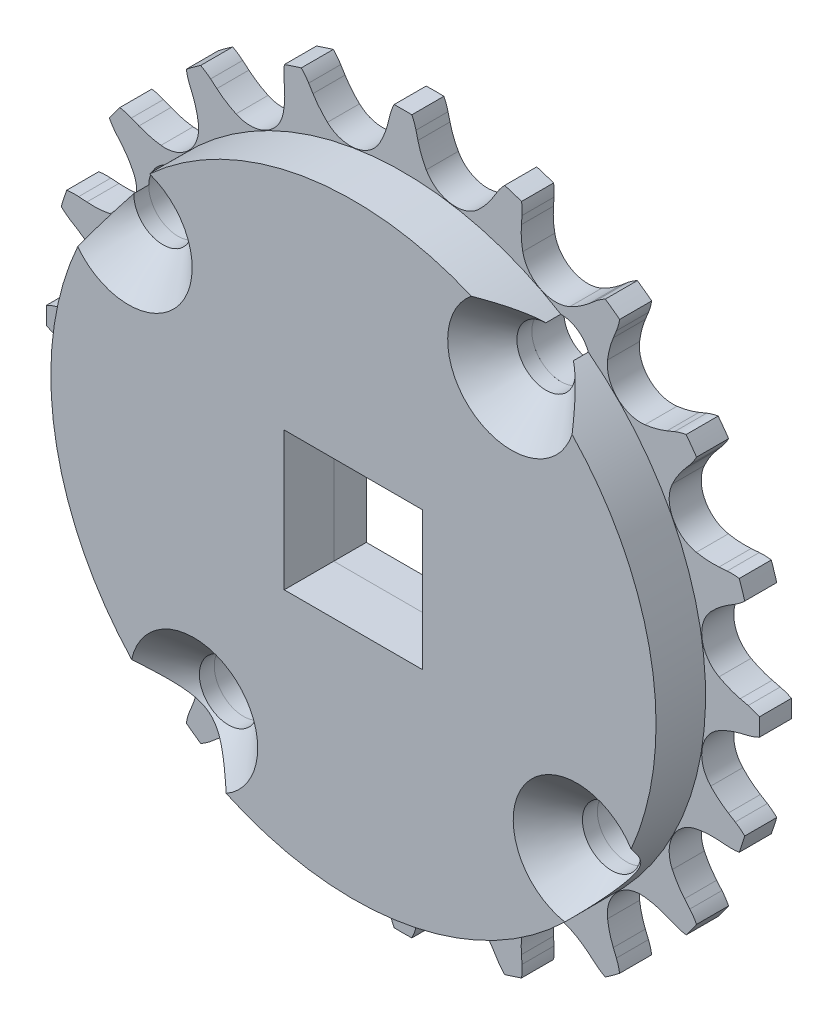
from build123d import *

# Parameters (mm, degrees)
SKETCH1_R                                    = 6.787119857
BOSS_EXTRUDE1_DEPTH                          = 2.3622
SKETCH2_R                                    = 18
BOSS_EXTRUDE2_DEPTH                          = 2.4
CUT_EXTRUDE1_START                           = -2.4
CUT_EXTRUDE1_OUTLINE_W                       = 10.2
CUT_EXTRUDE1_OUTLINE_H                       = 10.2
CUT_EXTRUDE1_DEPTH                           = 2.4
BOSS_EXTRUDE3_OUTLINE_R                      = 22.300536673
BOSS_EXTRUDE3_OUTLINE_W                      = 10.2
BOSS_EXTRUDE3_OUTLINE_H                      = 10.2
BOSS_EXTRUDE3_DEPTH                          = 3.65
SKETCH5_R                                    = 2
CUT_EXTRUDE3_DEPTH                           = 38.642889197
CSK_FOR_M4_COUNTERSUNK_FLAT_HEAD_SCR_2_COUNT = 2
CSK_FOR_M4_COUNTERSUNK_FLAT_HEAD_SCR_2_PITCH = 28.640006983
CSK_FOR_M4_COUNTERSUNK_FLAT_HEAD_SCR_3_COUNT = 2
CSK_FOR_M4_COUNTERSUNK_FLAT_HEAD_SCR_3_PITCH = 40.503086302
CSK_FOR_M4_COUNTERSUNK_FLAT_HEAD_SCR_4_COUNT = 2
CSK_FOR_M4_COUNTERSUNK_FLAT_HEAD_SCR_4_PITCH = 28.640006983


# Read off the part's stored shape, not the designer's step: Cut-Extrude1, Boss-Extrude3
with BuildPart() as part:
    # Sketch1 → Boss-Extrude1 (new body)
    with BuildSketch(Plane.XY.offset(0.25)):
        with BuildLine():
            Line((-24.488227524, 6.948596415), (-23.976513369, 6.631320197))
            ThreePointArc((-23.976513369, 6.631320197), (-23.291994454, 6.141252786), (-22.678303214, 5.564958353))
            ThreePointArc((-22.678303214, 5.564958353), (-22.044379306, 3.491486679), (-23.288014754, 1.715391192))
            ThreePointArc((-23.288014754, 1.715391192), (-24.04975458, 1.356943638), (-24.852209913, 1.102389812))
            Line((-24.852209913, 1.102389812), (-25.436922738, 0.958770568))
            ThreePointArc((-25.436922738, 0.958770568), (-25.860833079, 0.829247508), (-26.267723996, 0.653418098))
            ThreePointArc((-26.267723996, 0.653418098), (-26.275849732, 0), (-26.267723996, -0.653418098))
            ThreePointArc((-26.267723996, -0.653418098), (-25.860833079, -0.829247508), (-25.436922738, -0.958770568))
            Line((-25.436922738, -0.958770568), (-24.852209913, -1.102389812))
            ThreePointArc((-24.852209913, -1.102389812), (-24.04975458, -1.356943638), (-23.288014754, -1.715391192))
            ThreePointArc((-23.288014754, -1.715391192), (-22.044379306, -3.491486679), (-22.678303214, -5.564958353))
            ThreePointArc((-22.678303214, -5.564958353), (-23.291994454, -6.141252786), (-23.976513369, -6.631320197))
            Line((-23.976513369, -6.631320197), (-24.488227524, -6.948596415))
            ThreePointArc((-24.488227524, -6.948596415), (-24.851365389, -7.202775664), (-25.184007371, -7.495735579))
            ThreePointArc((-25.184007371, -7.495735579), (-24.989818108, -8.119684109), (-24.780172778, -8.738610658))
            ThreePointArc((-24.780172778, -8.738610658), (-24.338862244, -8.780098157), (-23.895674726, -8.772286407))
            Line((-23.895674726, -8.772286407), (-23.295198996, -8.728190226))
            ThreePointArc((-23.295198996, -8.728190226), (-22.453357164, -8.722312965), (-21.618133153, -8.827826296))
            ThreePointArc((-21.618133153, -8.827826296), (-19.886521867, -10.132688993), (-19.848681346, -12.300571001))
            ThreePointArc((-19.848681346, -12.300571001), (-20.254251625, -13.0383006), (-20.753828642, -13.715910381))
            Line((-20.753828642, -13.715910381), (-21.14245398, -14.175786366))
            ThreePointArc((-21.14245398, -14.175786366), (-21.409272906, -14.529740969), (-21.635104637, -14.911154431))
            ThreePointArc((-21.635104637, -14.911154431), (-21.257608974, -15.444556964), (-20.866965595, -15.968407121))
            ThreePointArc((-20.866965595, -15.968407121), (-20.434433994, -15.871491623), (-20.01535158, -15.727109732))
            Line((-20.01535158, -15.727109732), (-19.457891694, -15.499614567))
            ThreePointArc((-19.457891694, -15.499614567), (-18.659068707, -15.233881527), (-17.832118057, -15.076132254))
            ThreePointArc((-17.832118057, -15.076132254), (-15.782033111, -15.782033111), (-15.076132254, -17.832118057))
            ThreePointArc((-15.076132254, -17.832118057), (-15.233881527, -18.659068707), (-15.499614567, -19.457891694))
            Line((-15.499614567, -19.457891694), (-15.727109732, -20.01535158))
            ThreePointArc((-15.727109732, -20.01535158), (-15.871491623, -20.434433994), (-15.968407121, -20.866965595))
            ThreePointArc((-15.968407121, -20.866965595), (-15.444556964, -21.257608974), (-14.911154431, -21.635104637))
            ThreePointArc((-14.911154431, -21.635104637), (-14.529740969, -21.409272906), (-14.175786366, -21.14245398))
            Line((-14.175786366, -21.14245398), (-13.715910381, -20.753828642))
            ThreePointArc((-13.715910381, -20.753828642), (-13.0383006, -20.254251625), (-12.300571001, -19.848681346))
            ThreePointArc((-12.300571001, -19.848681346), (-10.132688993, -19.886521867), (-8.827826296, -21.618133153))
            ThreePointArc((-8.827826296, -21.618133153), (-8.722312965, -22.453357164), (-8.728190226, -23.295198996))
            Line((-8.728190226, -23.295198996), (-8.772286407, -23.895674726))
            ThreePointArc((-8.772286407, -23.895674726), (-8.780098157, -24.338862244), (-8.738610658, -24.780172778))
            ThreePointArc((-8.738610658, -24.780172778), (-8.119684109, -24.989818108), (-7.495735579, -25.184007371))
            ThreePointArc((-7.495735579, -25.184007371), (-7.202775664, -24.851365389), (-6.948596415, -24.488227524))
            Line((-6.948596415, -24.488227524), (-6.631320197, -23.976513369))
            ThreePointArc((-6.631320197, -23.976513369), (-6.141252786, -23.291994454), (-5.564958353, -22.678303214))
            ThreePointArc((-5.564958353, -22.678303214), (-3.491486679, -22.044379306), (-1.715391192, -23.288014754))
            ThreePointArc((-1.715391192, -23.288014754), (-1.356943638, -24.04975458), (-1.102389812, -24.852209913))
            Line((-1.102389812, -24.852209913), (-0.958770568, -25.436922738))
            ThreePointArc((-0.958770568, -25.436922738), (-0.829247508, -25.860833079), (-0.653418098, -26.267723996))
            ThreePointArc((-0.653418098, -26.267723996), (0, -26.275849732), (0.653418098, -26.267723996))
            ThreePointArc((0.653418098, -26.267723996), (0.829247508, -25.860833079), (0.958770568, -25.436922738))
            Line((0.958770568, -25.436922738), (1.102389812, -24.852209913))
            ThreePointArc((1.102389812, -24.852209913), (1.356943638, -24.04975458), (1.715391192, -23.288014754))
            ThreePointArc((1.715391192, -23.288014754), (3.491486679, -22.044379306), (5.564958353, -22.678303214))
            ThreePointArc((5.564958353, -22.678303214), (6.141252786, -23.291994454), (6.631320197, -23.976513369))
            Line((6.631320197, -23.976513369), (6.948596415, -24.488227524))
            ThreePointArc((6.948596415, -24.488227524), (7.202775664, -24.851365389), (7.495735579, -25.184007371))
            ThreePointArc((7.495735579, -25.184007371), (8.119684109, -24.989818108), (8.738610658, -24.780172778))
            ThreePointArc((8.738610658, -24.780172778), (8.780098157, -24.338862244), (8.772286407, -23.895674726))
            Line((8.772286407, -23.895674726), (8.728190226, -23.295198996))
            ThreePointArc((8.728190226, -23.295198996), (8.722312965, -22.453357164), (8.827826296, -21.618133153))
            ThreePointArc((8.827826296, -21.618133153), (10.132688993, -19.886521867), (12.300571001, -19.848681346))
            ThreePointArc((12.300571001, -19.848681346), (13.0383006, -20.254251625), (13.715910381, -20.753828642))
            Line((13.715910381, -20.753828642), (14.175786366, -21.14245398))
            ThreePointArc((14.175786366, -21.14245398), (14.529740969, -21.409272906), (14.911154431, -21.635104637))
            ThreePointArc((14.911154431, -21.635104637), (15.444556964, -21.257608974), (15.968407121, -20.866965595))
            ThreePointArc((15.968407121, -20.866965595), (15.871491623, -20.434433994), (15.727109732, -20.01535158))
            Line((15.727109732, -20.01535158), (15.499614567, -19.457891694))
            ThreePointArc((15.499614567, -19.457891694), (15.233881527, -18.659068707), (15.076132254, -17.832118057))
            ThreePointArc((15.076132254, -17.832118057), (15.782033111, -15.782033111), (17.832118057, -15.076132254))
            ThreePointArc((17.832118057, -15.076132254), (18.659068707, -15.233881527), (19.457891694, -15.499614567))
            Line((19.457891694, -15.499614567), (20.01535158, -15.727109732))
            ThreePointArc((20.01535158, -15.727109732), (20.434433994, -15.871491623), (20.866965595, -15.968407121))
            ThreePointArc((20.866965595, -15.968407121), (21.257608974, -15.444556964), (21.635104637, -14.911154431))
            ThreePointArc((21.635104637, -14.911154431), (21.409272906, -14.529740969), (21.14245398, -14.175786366))
            Line((21.14245398, -14.175786366), (20.753828642, -13.715910381))
            ThreePointArc((20.753828642, -13.715910381), (20.254251625, -13.0383006), (19.848681346, -12.300571001))
            ThreePointArc((19.848681346, -12.300571001), (19.886521867, -10.132688993), (21.618133153, -8.827826296))
            ThreePointArc((21.618133153, -8.827826296), (22.453357164, -8.722312965), (23.295198996, -8.728190226))
            Line((23.295198996, -8.728190226), (23.895674726, -8.772286407))
            ThreePointArc((23.895674726, -8.772286407), (24.338862244, -8.780098157), (24.780172778, -8.738610658))
            ThreePointArc((24.780172778, -8.738610658), (24.989818108, -8.119684109), (25.184007371, -7.495735579))
            ThreePointArc((25.184007371, -7.495735579), (24.851365389, -7.202775664), (24.488227524, -6.948596415))
            Line((24.488227524, -6.948596415), (23.976513369, -6.631320197))
            ThreePointArc((23.976513369, -6.631320197), (23.291994454, -6.141252786), (22.678303214, -5.564958353))
            ThreePointArc((22.678303214, -5.564958353), (22.044379306, -3.491486679), (23.288014754, -1.715391192))
            ThreePointArc((23.288014754, -1.715391192), (24.04975458, -1.356943638), (24.852209913, -1.102389812))
            Line((24.852209913, -1.102389812), (25.436922738, -0.958770568))
            ThreePointArc((25.436922738, -0.958770568), (25.860833079, -0.829247508), (26.267723996, -0.653418098))
            ThreePointArc((26.267723996, -0.653418098), (26.275849732, 0), (26.267723996, 0.653418098))
            ThreePointArc((26.267723996, 0.653418098), (25.860833079, 0.829247508), (25.436922738, 0.958770568))
            Line((25.436922738, 0.958770568), (24.852209913, 1.102389812))
            ThreePointArc((24.852209913, 1.102389812), (24.04975458, 1.356943638), (23.288014754, 1.715391192))
            ThreePointArc((23.288014754, 1.715391192), (22.044379306, 3.491486679), (22.678303214, 5.564958353))
            ThreePointArc((22.678303214, 5.564958353), (23.291994454, 6.141252786), (23.976513369, 6.631320197))
            Line((23.976513369, 6.631320197), (24.488227524, 6.948596415))
            ThreePointArc((24.488227524, 6.948596415), (24.851365389, 7.202775664), (25.184007371, 7.495735579))
            ThreePointArc((25.184007371, 7.495735579), (24.989818108, 8.119684109), (24.780172778, 8.738610658))
            ThreePointArc((24.780172778, 8.738610658), (24.338862244, 8.780098157), (23.895674726, 8.772286407))
            Line((23.895674726, 8.772286407), (23.295198996, 8.728190226))
            ThreePointArc((23.295198996, 8.728190226), (22.453357164, 8.722312965), (21.618133153, 8.827826296))
            ThreePointArc((21.618133153, 8.827826296), (19.886521867, 10.132688993), (19.848681346, 12.300571001))
            ThreePointArc((19.848681346, 12.300571001), (20.254251625, 13.0383006), (20.753828642, 13.715910381))
            Line((20.753828642, 13.715910381), (21.14245398, 14.175786366))
            ThreePointArc((21.14245398, 14.175786366), (21.409272906, 14.529740969), (21.635104637, 14.911154431))
            ThreePointArc((21.635104637, 14.911154431), (21.257608974, 15.444556964), (20.866965595, 15.968407121))
            ThreePointArc((20.866965595, 15.968407121), (20.434433994, 15.871491623), (20.01535158, 15.727109732))
            Line((20.01535158, 15.727109732), (19.457891694, 15.499614567))
            ThreePointArc((19.457891694, 15.499614567), (18.659068707, 15.233881527), (17.832118057, 15.076132254))
            ThreePointArc((17.832118057, 15.076132254), (15.782033111, 15.782033111), (15.076132254, 17.832118057))
            ThreePointArc((15.076132254, 17.832118057), (15.233881527, 18.659068707), (15.499614567, 19.457891694))
            Line((15.499614567, 19.457891694), (15.727109732, 20.01535158))
            ThreePointArc((15.727109732, 20.01535158), (15.871491623, 20.434433994), (15.968407121, 20.866965595))
            ThreePointArc((15.968407121, 20.866965595), (15.444556964, 21.257608974), (14.911154431, 21.635104637))
            ThreePointArc((14.911154431, 21.635104637), (14.529740969, 21.409272906), (14.175786366, 21.14245398))
            Line((14.175786366, 21.14245398), (13.715910381, 20.753828642))
            ThreePointArc((13.715910381, 20.753828642), (13.0383006, 20.254251625), (12.300571001, 19.848681346))
            ThreePointArc((12.300571001, 19.848681346), (10.132688993, 19.886521867), (8.827826296, 21.618133153))
            ThreePointArc((8.827826296, 21.618133153), (8.722312965, 22.453357164), (8.728190226, 23.295198996))
            Line((8.728190226, 23.295198996), (8.772286407, 23.895674726))
            ThreePointArc((8.772286407, 23.895674726), (8.780098157, 24.338862244), (8.738610658, 24.780172778))
            ThreePointArc((8.738610658, 24.780172778), (8.119684109, 24.989818108), (7.495735579, 25.184007371))
            ThreePointArc((7.495735579, 25.184007371), (7.202775664, 24.851365389), (6.948596415, 24.488227524))
            Line((6.948596415, 24.488227524), (6.631320197, 23.976513369))
            ThreePointArc((6.631320197, 23.976513369), (6.141252786, 23.291994454), (5.564958353, 22.678303214))
            ThreePointArc((5.564958353, 22.678303214), (3.491486679, 22.044379306), (1.715391192, 23.288014754))
            ThreePointArc((1.715391192, 23.288014754), (1.356943638, 24.04975458), (1.102389812, 24.852209913))
            Line((1.102389812, 24.852209913), (0.958770568, 25.436922738))
            ThreePointArc((0.958770568, 25.436922738), (0.829247508, 25.860833079), (0.653418098, 26.267723996))
            ThreePointArc((0.653418098, 26.267723996), (0, 26.275849732), (-0.653418098, 26.267723996))
            ThreePointArc((-0.653418098, 26.267723996), (-0.829247508, 25.860833079), (-0.958770568, 25.436922738))
            Line((-0.958770568, 25.436922738), (-1.102389812, 24.852209913))
            ThreePointArc((-1.102389812, 24.852209913), (-1.356943638, 24.04975458), (-1.715391192, 23.288014754))
            ThreePointArc((-1.715391192, 23.288014754), (-3.491486679, 22.044379306), (-5.564958353, 22.678303214))
            ThreePointArc((-5.564958353, 22.678303214), (-6.141252786, 23.291994454), (-6.631320197, 23.976513369))
            Line((-6.631320197, 23.976513369), (-6.948596415, 24.488227524))
            ThreePointArc((-6.948596415, 24.488227524), (-7.202775664, 24.851365389), (-7.495735579, 25.184007371))
            ThreePointArc((-7.495735579, 25.184007371), (-8.119684109, 24.989818108), (-8.738610658, 24.780172778))
            ThreePointArc((-8.738610658, 24.780172778), (-8.780098157, 24.338862244), (-8.772286407, 23.895674726))
            Line((-8.772286407, 23.895674726), (-8.728190226, 23.295198996))
            ThreePointArc((-8.728190226, 23.295198996), (-8.722312965, 22.453357164), (-8.827826296, 21.618133153))
            ThreePointArc((-8.827826296, 21.618133153), (-10.132688993, 19.886521867), (-12.300571001, 19.848681346))
            ThreePointArc((-12.300571001, 19.848681346), (-13.0383006, 20.254251625), (-13.715910381, 20.753828642))
            Line((-13.715910381, 20.753828642), (-14.175786366, 21.14245398))
            ThreePointArc((-14.175786366, 21.14245398), (-14.529740969, 21.409272906), (-14.911154431, 21.635104637))
            ThreePointArc((-14.911154431, 21.635104637), (-15.444556964, 21.257608974), (-15.968407121, 20.866965595))
            ThreePointArc((-15.968407121, 20.866965595), (-15.871491623, 20.434433994), (-15.727109732, 20.01535158))
            Line((-15.727109732, 20.01535158), (-15.499614567, 19.457891694))
            ThreePointArc((-15.499614567, 19.457891694), (-15.233881527, 18.659068707), (-15.076132254, 17.832118057))
            ThreePointArc((-15.076132254, 17.832118057), (-15.782033111, 15.782033111), (-17.832118057, 15.076132254))
            ThreePointArc((-17.832118057, 15.076132254), (-18.659068707, 15.233881527), (-19.457891694, 15.499614567))
            Line((-19.457891694, 15.499614567), (-20.01535158, 15.727109732))
            ThreePointArc((-20.01535158, 15.727109732), (-20.434433994, 15.871491623), (-20.866965595, 15.968407121))
            ThreePointArc((-20.866965595, 15.968407121), (-21.257608974, 15.444556964), (-21.635104637, 14.911154431))
            ThreePointArc((-21.635104637, 14.911154431), (-21.409272906, 14.529740969), (-21.14245398, 14.175786366))
            Line((-21.14245398, 14.175786366), (-20.753828642, 13.715910381))
            ThreePointArc((-20.753828642, 13.715910381), (-20.254251625, 13.0383006), (-19.848681346, 12.300571001))
            ThreePointArc((-19.848681346, 12.300571001), (-19.886521867, 10.132688993), (-21.618133153, 8.827826296))
            ThreePointArc((-21.618133153, 8.827826296), (-22.453357164, 8.722312965), (-23.295198996, 8.728190226))
            Line((-23.295198996, 8.728190226), (-23.895674726, 8.772286407))
            ThreePointArc((-23.895674726, 8.772286407), (-24.338862244, 8.780098157), (-24.780172778, 8.738610658))
            ThreePointArc((-24.780172778, 8.738610658), (-24.989818108, 8.119684109), (-25.184007371, 7.495735579))
            ThreePointArc((-25.184007371, 7.495735579), (-24.851365389, 7.202775664), (-24.488227524, 6.948596415))
        make_face()
        with Locations(Location((0, 0, 0), (0, 0, 180))):
            Circle(SKETCH1_R, mode=Mode.SUBTRACT)
        with BuildLine():
            Line((6.385503129, 9.127913687), (6.856026394, 9.598436951))
            ThreePointArc((6.856026394, 9.598436951), (9.598436951, 9.598436951), (9.598436951, 6.856026394))
            Line((9.598436951, 6.856026394), (9.127913687, 6.385503129))
            ThreePointArc((9.127913687, 6.385503129), (6.385503129, 6.385503129), (6.385503129, 9.127913687))
        make_face(mode=Mode.SUBTRACT)
        with BuildLine():
            Line((9.127913687, -6.385503129), (9.598436951, -6.856026394))
            ThreePointArc((9.598436951, -6.856026394), (9.598436951, -9.598436951), (6.856026394, -9.598436951))
            Line((6.856026394, -9.598436951), (6.385503129, -9.127913687))
            ThreePointArc((6.385503129, -9.127913687), (6.385503129, -6.385503129), (9.127913687, -6.385503129))
        make_face(mode=Mode.SUBTRACT)
        with BuildLine():
            Line((-6.385503129, -9.127913687), (-6.856026394, -9.598436951))
            ThreePointArc((-6.856026394, -9.598436951), (-9.598436951, -9.598436951), (-9.598436951, -6.856026394))
            Line((-9.598436951, -6.856026394), (-9.127913687, -6.385503129))
            ThreePointArc((-9.127913687, -6.385503129), (-6.385503129, -6.385503129), (-6.385503129, -9.127913687))
        make_face(mode=Mode.SUBTRACT)
        with BuildLine():
            Line((1.939177102, 15.513416816), (1.939177102, 10.96964223))
            ThreePointArc((1.939177102, 10.96964223), (0, 9.030465128), (-1.939177102, 10.96964223))
            Line((-1.939177102, 10.96964223), (-1.939177102, 15.513416816))
            ThreePointArc((-1.939177102, 15.513416816), (0, 17.452593918), (1.939177102, 15.513416816))
        make_face(mode=Mode.SUBTRACT)
        with BuildLine():
            Line((-1.939177102, -15.513416816), (-1.939177102, -10.96964223))
            ThreePointArc((-1.939177102, -10.96964223), (0, -9.030465128), (1.939177102, -10.96964223))
            Line((1.939177102, -10.96964223), (1.939177102, -15.513416816))
            ThreePointArc((1.939177102, -15.513416816), (0, -17.452593918), (-1.939177102, -15.513416816))
        make_face(mode=Mode.SUBTRACT)
        with BuildLine():
            Line((15.513416816, -1.939177102), (10.96964223, -1.939177102))
            ThreePointArc((10.96964223, -1.939177102), (9.030465128, 0), (10.96964223, 1.939177102))
            Line((10.96964223, 1.939177102), (15.513416816, 1.939177102))
            ThreePointArc((15.513416816, 1.939177102), (17.452593918, 0), (15.513416816, -1.939177102))
        make_face(mode=Mode.SUBTRACT)
        with BuildLine():
            Line((-15.513416816, 1.939177102), (-10.96964223, 1.939177102))
            ThreePointArc((-10.96964223, 1.939177102), (-9.030465128, 0), (-10.96964223, -1.939177102))
            Line((-10.96964223, -1.939177102), (-15.513416816, -1.939177102))
            ThreePointArc((-15.513416816, -1.939177102), (-17.452593918, 0), (-15.513416816, 1.939177102))
        make_face(mode=Mode.SUBTRACT)
        with BuildLine():
            Line((-6.856026394, 9.598436951), (-6.385503129, 9.127913687))
            ThreePointArc((-6.385503129, 9.127913687), (-6.385503129, 6.385503129), (-9.127913687, 6.385503129))
            Line((-9.127913687, 6.385503129), (-9.598436951, 6.856026394))
            ThreePointArc((-9.598436951, 6.856026394), (-9.598436951, 9.598436951), (-6.856026394, 9.598436951))
        make_face(mode=Mode.SUBTRACT)
    extrude(amount=-BOSS_EXTRUDE1_DEPTH)


with BuildPart() as body_2:
    # Sketch2 → Boss-Extrude2 (new body)
    with BuildSketch(Plane.XY.offset(0.25)):
        Circle(SKETCH2_R)
    extrude(amount=-BOSS_EXTRUDE2_DEPTH)


with BuildPart() as cut_extrude1_tool:
    # Cut-Extrude1 outline → Cut-Extrude1 (new body)
    with BuildSketch(Plane.XY.offset(0.25).offset(CUT_EXTRUDE1_START)):
        Rectangle(CUT_EXTRUDE1_OUTLINE_W, CUT_EXTRUDE1_OUTLINE_H)
    extrude(amount=CUT_EXTRUDE1_DEPTH)


with BuildPart() as part_1:
    add(part.part)

    # Cut-Extrude1: cut by cut_extrude1_tool
    add(cut_extrude1_tool.part, mode=Mode.SUBTRACT)


with BuildPart() as body_2_1:
    add(body_2.part)

    # Cut-Extrude1: cut by cut_extrude1_tool
    add(cut_extrude1_tool.part, mode=Mode.SUBTRACT)


with BuildPart() as body_3:
    # Boss-Extrude3 outline → Boss-Extrude3 (new body)
    with BuildSketch(Plane.XY.offset(0.25)):
        Circle(BOSS_EXTRUDE3_OUTLINE_R)
        Rectangle(BOSS_EXTRUDE3_OUTLINE_W, BOSS_EXTRUDE3_OUTLINE_H, mode=Mode.SUBTRACT)
    extrude(amount=BOSS_EXTRUDE3_DEPTH)


with BuildPart() as cut_extrude3_tool:
    # Sketch5 → Cut-Extrude3 (new, through all)
    with BuildSketch(Plane(origin=(0, 0, -2.1122), x_dir=(-1, 0, 0), z_dir=(0, 0, -1))):
        with BuildLine():
            ThreePointArc((18.584848385, 12.049597672), (18.486961417, 12.667631661), (18.202882373, 13.225168177))
            Line((18.202882373, 13.225168177), (14.966814396, 10.874027167))
            ThreePointArc((14.966814396, 10.874027167), (17.202882373, 10.147484639), (18.584848385, 12.049597672))
        make_face()
        with BuildLine():
            Line((14.966814396, 10.874027167), (18.202882373, 13.225168177))
            ThreePointArc((18.202882373, 13.225168177), (15.40927788, 13.667631661), (14.966814396, 10.874027167))
        make_face()
        with Locations((11.755705046, -16.180339887)):
            Circle(SKETCH5_R)
        with Locations((-16.474232514, -11.351196549)):
            Circle(SKETCH5_R)
        with Locations((-11.645089175, 16.878741011)):
            Circle(SKETCH5_R)
    extrude(amount=-CUT_EXTRUDE3_DEPTH)


with BuildPart() as part_2:
    add(part_1.part)

    # Cut-Extrude3: cut by cut_extrude3_tool
    add(cut_extrude3_tool.part, mode=Mode.SUBTRACT)


with BuildPart() as body_3_1:
    add(body_3.part)

    # Cut-Extrude3: cut by cut_extrude3_tool
    add(cut_extrude3_tool.part, mode=Mode.SUBTRACT)


with BuildPart() as csk_for_m4_countersunk_flat_head_screw1_tool:
    # Sketch8 → CSK for M4 Countersunk Flat Head Screw1 (revolve)
    with BuildSketch(Plane(origin=(-16.584848385, 12.049597672, 3.9), x_dir=(0, -1, 0), z_dir=(1, 0, 0))):
        Polygon((0, 0), (0, 6.0122), (2.15, 6.0122), (2.15, 2.55), (4.7, 0), align=None)
    csk_for_m4_countersunk_flat_head_screw1 = revolve(axis=Axis((-16.584848385, 12.049597672, 10.25), (0, 0, -1)))


with BuildPart() as part_3:
    add(part_2.part)

    # CSK for M4 Countersunk Flat Head Screw1: cut by csk_for_m4_countersunk_flat_head_screw1_tool
    add(csk_for_m4_countersunk_flat_head_screw1_tool.part, mode=Mode.SUBTRACT)


with BuildPart() as body_3_2:
    add(body_3_1.part)

    # CSK for M4 Countersunk Flat Head Screw1: cut by csk_for_m4_countersunk_flat_head_screw1_tool
    add(csk_for_m4_countersunk_flat_head_screw1_tool.part, mode=Mode.SUBTRACT)


with BuildPart() as csk_for_m4_countersunk_flat_head_scr_2_tool:
    # CSK for M4 Countersunk Flat Head Scr 2: CSK for M4 Countersunk Flat Head Screw1 ×2
    with Locations(*[Vector(0.16861529892999055, -0.9856819370196199, 0) * (i * CSK_FOR_M4_COUNTERSUNK_FLAT_HEAD_SCR_2_PITCH) for i in range(1, CSK_FOR_M4_COUNTERSUNK_FLAT_HEAD_SCR_2_COUNT)]):
        add(csk_for_m4_countersunk_flat_head_screw1)


with BuildPart() as part_4:
    add(part_3.part)

    # CSK for M4 Countersunk Flat Head Scr 2: cut by csk_for_m4_countersunk_flat_head_scr_2_tool
    add(csk_for_m4_countersunk_flat_head_scr_2_tool.part, mode=Mode.SUBTRACT)


with BuildPart() as body_2_2:
    add(body_2_1.part)

    # CSK for M4 Countersunk Flat Head Scr 2: cut by csk_for_m4_countersunk_flat_head_scr_2_tool
    add(csk_for_m4_countersunk_flat_head_scr_2_tool.part, mode=Mode.SUBTRACT)


with BuildPart() as body_3_3:
    add(body_3_2.part)

    # CSK for M4 Countersunk Flat Head Scr 2: cut by csk_for_m4_countersunk_flat_head_scr_2_tool
    add(csk_for_m4_countersunk_flat_head_scr_2_tool.part, mode=Mode.SUBTRACT)


with BuildPart() as csk_for_m4_countersunk_flat_head_scr_3_tool:
    # CSK for M4 Countersunk Flat Head Scr 3: CSK for M4 Countersunk Flat Head Screw1 ×2
    with Locations(*[Vector(0.8162114030448578, -0.5777533604744715, 0) * (i * CSK_FOR_M4_COUNTERSUNK_FLAT_HEAD_SCR_3_PITCH) for i in range(1, CSK_FOR_M4_COUNTERSUNK_FLAT_HEAD_SCR_3_COUNT)]):
        add(csk_for_m4_countersunk_flat_head_screw1)


with BuildPart() as part_5:
    add(part_4.part)

    # CSK for M4 Countersunk Flat Head Scr 3: cut by csk_for_m4_countersunk_flat_head_scr_3_tool
    add(csk_for_m4_countersunk_flat_head_scr_3_tool.part, mode=Mode.SUBTRACT)


with BuildPart() as body_2_3:
    add(body_2_2.part)

    # CSK for M4 Countersunk Flat Head Scr 3: cut by csk_for_m4_countersunk_flat_head_scr_3_tool
    add(csk_for_m4_countersunk_flat_head_scr_3_tool.part, mode=Mode.SUBTRACT)


with BuildPart() as body_3_4:
    add(body_3_3.part)

    # CSK for M4 Countersunk Flat Head Scr 3: cut by csk_for_m4_countersunk_flat_head_scr_3_tool
    add(csk_for_m4_countersunk_flat_head_scr_3_tool.part, mode=Mode.SUBTRACT)


with BuildPart() as csk_for_m4_countersunk_flat_head_scr_4_tool:
    # CSK for M4 Countersunk Flat Head Scr 4: CSK for M4 Countersunk Flat Head Screw1 ×2
    with Locations(*[Vector(0.9856819370196199, 0.16861529892999058, 0) * (i * CSK_FOR_M4_COUNTERSUNK_FLAT_HEAD_SCR_4_PITCH) for i in range(1, CSK_FOR_M4_COUNTERSUNK_FLAT_HEAD_SCR_4_COUNT)]):
        add(csk_for_m4_countersunk_flat_head_screw1)


with BuildPart() as part_6:
    add(part_5.part)

    # CSK for M4 Countersunk Flat Head Scr 4: cut by csk_for_m4_countersunk_flat_head_scr_4_tool
    add(csk_for_m4_countersunk_flat_head_scr_4_tool.part, mode=Mode.SUBTRACT)


with BuildPart() as body_3_5:
    add(body_3_4.part)

    # CSK for M4 Countersunk Flat Head Scr 4: cut by csk_for_m4_countersunk_flat_head_scr_4_tool
    add(csk_for_m4_countersunk_flat_head_scr_4_tool.part, mode=Mode.SUBTRACT)


solid = Compound([body_2_3.part, part_6.part, body_3_5.part])
